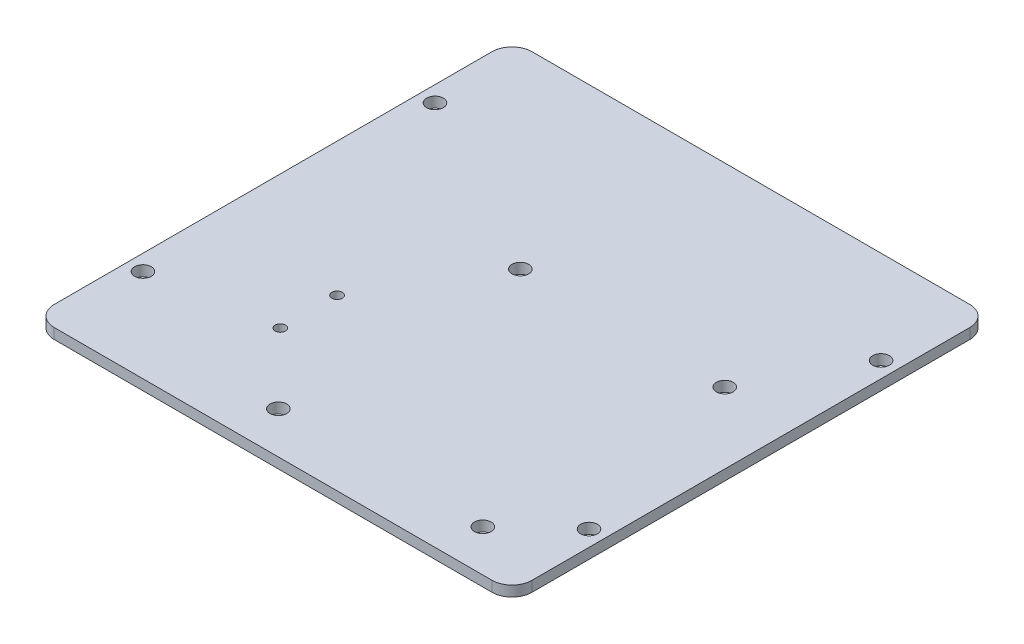
from build123d import *

# Parameters (mm, degrees)
ESQUISSE1_R        = 2
BOSS_EXTRU_1_DEPTH = 2.5
ESQUISSE3_R        = 2
TROUS_RPI_DEPTH    = 83.48457809
ESQUISSE5_R        = 1.25
TROUS_ICM_DEPTH    = 83.48457809


with BuildPart() as part:
    # Esquisse1 → Boss.-Extru.1 (new body)
    with BuildSketch(Plane(origin=(0, 0, 0), x_dir=(1, 0, 0), z_dir=(0, 1, 0))):
        with BuildLine():
            Line((51.427997, 56.227997), (4.964694, 56.227997))
            Line((4.964694, 56.227997), (-7.035306, 56.227997))
            Line((-7.035306, 56.227997), (-53.498609, 56.227997))
            ThreePointArc((-53.498609, 56.227997), (-56.89272155, 54.82210955), (-58.298609, 51.427997))
            Line((-58.298609, 51.427997), (-58.298609, -53.498609))
            ThreePointArc((-58.298609, -53.498609), (-56.89272155, -56.89272155), (-53.498609, -58.298609))
            Line((-53.498609, -58.298609), (-7.035306, -58.298609))
            Line((-7.035306, -58.298609), (4.964694, -58.298609))
            Line((4.964694, -58.298609), (51.427997, -58.298609))
            ThreePointArc((51.427997, -58.298609), (54.82210955, -56.89272155), (56.227997, -53.498609))
            Line((56.227997, -53.498609), (56.227997, 51.427997))
            ThreePointArc((56.227997, 51.427997), (54.82210955, 54.82210955), (51.427997, 56.227997))
        make_face()
        with Locations((-54.498609, -36.035306)):
            Circle(ESQUISSE1_R, mode=Mode.SUBTRACT)
        with Locations((52.427997, -36.035306)):
            Circle(ESQUISSE1_R, mode=Mode.SUBTRACT)
        with Locations((-54.498609, 33.964694)):
            Circle(ESQUISSE1_R, mode=Mode.SUBTRACT)
        with Locations((52.427997, 33.964694)):
            Circle(ESQUISSE1_R, mode=Mode.SUBTRACT)
    extrude(amount=BOSS_EXTRU_1_DEPTH)

    # Esquisse3 → Trous RPI (cut, through all)
    with BuildSketch(Plane(origin=(0, 2.5, 0), x_dir=(1, 0, 0), z_dir=(0, 1, 0))):
        with Locations((39.227997, 9.701391)):
            Circle(ESQUISSE3_R)
        with Locations((39.227997, -48.298609)):
            Circle(ESQUISSE3_R)
        with Locations((-9.772003, -48.298609)):
            Circle(ESQUISSE3_R)
        with Locations((-9.772003, 9.701391)):
            Circle(ESQUISSE3_R)
    extrude(amount=-TROUS_RPI_DEPTH, mode=Mode.SUBTRACT)

    # Esquisse5 → Trous ICM (cut, through all)
    with BuildSketch(Plane(origin=(0, 0, 0), x_dir=(-1, 0, 0), z_dir=(0, -1, 0))):
        with Locations((26.298609, -31.298609)):
            Circle(ESQUISSE5_R)
        with Locations((26.298609, -17.698609)):
            Circle(ESQUISSE5_R)
    extrude(amount=-TROUS_ICM_DEPTH, mode=Mode.SUBTRACT)


solid = part.part
